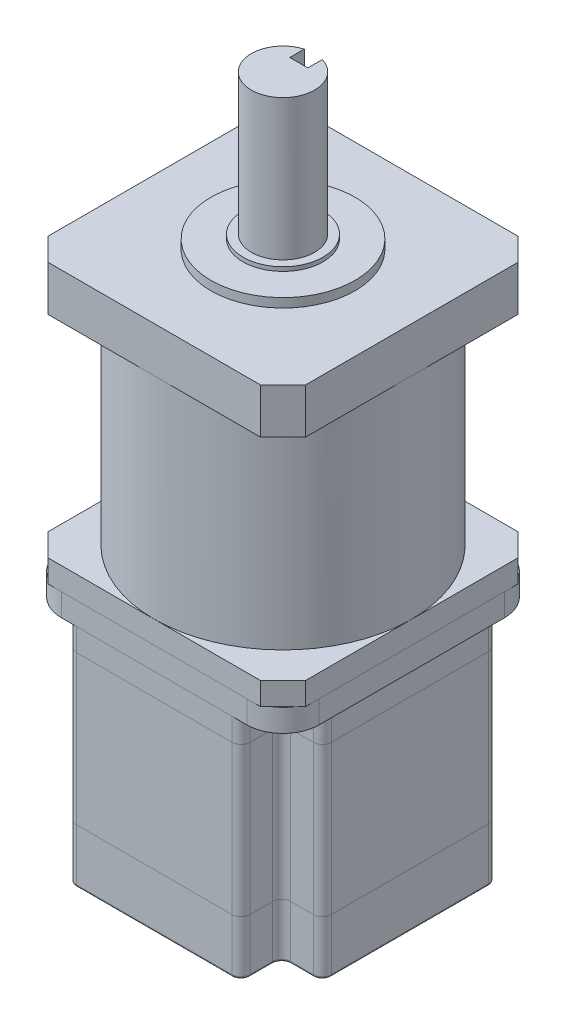
from build123d import *

# Parameters (mm, degrees)
SKETCH1_R            = 28.5
BOSS_EXTRUDE1_DEPTH  = 56.65
SKETCH2_W            = 57
SKETCH2_H            = 57
BOSS_EXTRUDE2_DEPTH  = 5
CHAMFER1_SIZE        = 5
SKETCH3_W            = 57
SKETCH3_H            = 57
BOSS_EXTRUDE3_DEPTH  = 5
SKETCH4_R            = 2.5
CUT_EXTRUDE1_DEPTH   = 15
BOSS_EXTRUDE4_DEPTH  = 5
BOSS_EXTRUDE5_DEPTH  = 33
BOSS_EXTRUDE6_DEPTH  = 12
FILLET1_R            = 2
FILLET2_R            = 2
FILLET3_R            = 2
FILLET4_R            = 0.5
FILLET5_R            = 8
SKETCH9_R            = 15.95
BOSS_EXTRUDE7_DEPTH  = 2
SKETCH10_R           = 8.85
BOSS_EXTRUDE8_DEPTH  = 0.9
SKETCH11_R           = 7
BOSS_EXTRUDE9_DEPTH  = 31.1
SKETCH12_W           = 4
SKETCH12_H           = 5.111692092
CUT_EXTRUDE2_DEPTH   = 20
FILLET6_R            = 2
BOSS_EXTRUDE10_DEPTH = 10


with BuildPart() as part:
    # Sketch1 → Boss-Extrude1 (new body)
    with BuildSketch(Plane(origin=(0, 0, 0), x_dir=(1, 0, 0), z_dir=(0, 1, 0))):
        with Locations(Location((0, 0, 0), (0, 0, 270))):
            Circle(SKETCH1_R)
    extrude(amount=BOSS_EXTRUDE1_DEPTH)

    # Sketch9 → Boss-Extrude7 (add)
    with BuildSketch(Plane(origin=(0, 56.65, 0), x_dir=(1, 0, 0), z_dir=(0, 1, 0))):
        with Locations(Location((0, 0, 0), (0, 0, 270))):
            Circle(SKETCH9_R)
    extrude(amount=BOSS_EXTRUDE7_DEPTH)

    # Sketch13 → Boss-Extrude10 (add)
    with BuildSketch(Plane(origin=(0, 56.65, 0), x_dir=(1, 0, 0), z_dir=(0, 1, 0))):
        Polygon((28.5, -23.5), (28.5, 23.5), (23.5, 28.5), (-23.5, 28.5), (-28.5, 23.5), (-28.5, -23.5), (-23.5, -28.5), (23.5, -28.5), align=None)
    extrude(amount=-BOSS_EXTRUDE10_DEPTH)


with BuildPart() as body_2:
    # Sketch2 → Boss-Extrude2 (new body)
    with BuildSketch(Plane.XZ):
        Rectangle(SKETCH2_W, SKETCH2_H)
    extrude(amount=BOSS_EXTRUDE2_DEPTH)

    # Chamfer1
    chamfer1_edges = [body_2.edges().sort_by_distance(p)[0] for p in [
        (28.5, -2.5, -28.5),
        (-28.5, -2.5, -28.5),
        (-28.5, -2.5, 28.5),
        (28.5, -2.5, 28.5),
    ]]
    chamfer(chamfer1_edges, length=CHAMFER1_SIZE)


with BuildPart() as body_3:
    # Sketch3 → Boss-Extrude3 (new body)
    with BuildSketch(Plane.XZ.offset(5)):
        Rectangle(SKETCH3_W, SKETCH3_H)
    extrude(amount=BOSS_EXTRUDE3_DEPTH)

    # Sketch4 → Cut-Extrude1 (cut)
    with BuildSketch(Plane.XZ.offset(10)):
        with Locations(Location((-23.5, 23.5, 0), (0, 0, 270))):
            Circle(SKETCH4_R)
        with Locations(Location((23.5, 23.5, 0), (0, 0, 270))):
            Circle(SKETCH4_R)
        with Locations(Location((23.5, -23.5, 0), (0, 0, 270))):
            Circle(SKETCH4_R)
        with Locations(Location((-23.5, -23.5, 0), (0, 0, 270))):
            Circle(SKETCH4_R)
    extrude(amount=-CUT_EXTRUDE1_DEPTH, mode=Mode.SUBTRACT)

    # Fillet5
    fillet5_edges = [body_3.edges().sort_by_distance(p)[0] for p in [
        (28.5, -7.5, -28.5),
        (-28.5, -7.5, -28.5),
        (-28.5, -7.5, 28.5),
        (28.5, -7.5, 28.5),
    ]]
    fillet(fillet5_edges, radius=FILLET5_R)


with BuildPart() as body_4:
    # Sketch6 → Boss-Extrude4 (new body)
    with BuildSketch(Plane.XZ.offset(10)):
        Polygon((-19.2, 28.5), (19.2, 28.5), (19.2, 19.5), (28.2, 19.5), (28.2, -19.25), (19.2, -19.25), (19.2, -28.25), (-19.2, -28.25), (-19.2, -19.25), (-28.2, -19.25), (-28.2, 19.5), (-19.2, 19.5), align=None)
    extrude(amount=BOSS_EXTRUDE4_DEPTH)

    # Fillet1
    fillet1_edges = [body_4.edges().sort_by_distance(p)[0] for p in [
        (19.2, -12.5, 19.5),
        (28.2, -12.5, 19.5),
        (28.2, -12.5, -19.25),
        (19.2, -12.5, -19.25),
        (19.2, -12.5, -28.25),
        (-19.2, -12.5, -28.25),
        (-19.2, -12.5, -19.25),
        (-28.2, -12.5, -19.25),
        (-28.2, -12.5, 19.5),
        (-19.2, -12.5, 19.5),
        (-19.2, -12.5, 28.5),
        (19.2, -12.5, 28.5),
    ]]
    fillet(fillet1_edges, radius=FILLET1_R)


with BuildPart() as body_5:
    # Sketch7 → Boss-Extrude5 (new body)
    with BuildSketch(Plane.XZ.offset(15)):
        Polygon((19.2, 19.5), (19.2, 28.5), (-19.2, 28.5), (-19.2, 19.5), (-28.2, 19.5), (-28.2, -19.25), (-19.2, -19.25), (-19.2, -28.25), (19.2, -28.25), (19.2, -19.25), (28.2, -19.25), (28.2, 19.5), align=None)
    extrude(amount=BOSS_EXTRUDE5_DEPTH)

    # Fillet2
    fillet2_edges = [body_5.edges().sort_by_distance(p)[0] for p in [
        (28.2, -31.5, 19.5),
        (28.2, -31.5, -19.25),
        (19.2, -31.5, -19.25),
        (19.2, -31.5, -28.25),
        (-19.2, -31.5, -28.25),
        (-19.2, -31.5, -19.25),
        (-28.2, -31.5, -19.25),
        (-28.2, -31.5, 19.5),
        (-19.2, -31.5, 19.5),
        (-19.2, -31.5, 28.5),
        (19.2, -31.5, 28.5),
        (19.2, -31.5, 19.5),
    ]]
    fillet(fillet2_edges, radius=FILLET2_R)


with BuildPart() as body_6:
    # Sketch8 → Boss-Extrude6 (new body)
    with BuildSketch(Plane.XZ.offset(48)):
        Polygon((28.2, 19.5), (19.2, 19.5), (19.2, 28.5), (-19.2, 28.5), (-19.2, 19.5), (-28.2, 19.5), (-28.2, -19.25), (-19.2, -19.25), (-19.2, -28.25), (19.2, -28.25), (19.2, -19.25), (28.2, -19.25), align=None)
    extrude(amount=BOSS_EXTRUDE6_DEPTH)

    # Fillet3
    fillet3_edges = [body_6.edges().sort_by_distance(p)[0] for p in [
        (28.2, -54, -19.25),
        (19.2, -54, -19.25),
        (19.2, -54, -28.25),
        (-19.2, -54, -28.25),
        (-19.2, -54, -19.25),
        (-28.2, -54, -19.25),
        (-28.2, -54, 19.5),
        (-19.2, -54, 19.5),
        (-19.2, -54, 28.5),
        (19.2, -54, 28.5),
        (19.2, -54, 19.5),
        (28.2, -54, 19.5),
    ]]
    fillet(fillet3_edges, radius=FILLET3_R)

    # Fillet4
    fillet4_edges = [body_6.edges().sort_by_distance(p)[0] for p in [
        (-28.2, -60, 0.125),
        (-23.7, -60, 19.5),
        (28.2, -60, 0.125),
        (23.7, -60, 19.5),
        (19.2, -60, 24),
        (0, -60, 28.5),
        (-19.2, -60, 24),
        (-23.7, -60, -19.25),
        (-19.2, -60, -23.75),
        (0, -60, -28.25),
        (19.2, -60, -23.75),
        (23.7, -60, -19.25),
        (-27.614213562, -60, -18.664213562),
        (-18.614213562, -60, -27.664213562),
        (18.614213562, -60, -27.664213562),
        (27.614213562, -60, -18.664213562),
        (27.614213562, -60, 18.914213562),
        (18.614213562, -60, 27.914213562),
        (-18.614213562, -60, 27.914213562),
        (-27.614213562, -60, 18.914213562),
        (-19.785786438, -60, 20.085786438),
        (19.785786438, -60, 20.085786438),
        (19.785786438, -60, -19.835786438),
        (-19.785786438, -60, -19.835786438),
    ]]
    fillet(fillet4_edges, radius=FILLET4_R)


with BuildPart() as body_7:
    # Sketch10 → Boss-Extrude8 (new body)
    with BuildSketch(Plane(origin=(0, 58.65, 0), x_dir=(1, 0, 0), z_dir=(0, 1, 0))):
        with Locations(Location((0, 0, 0), (0, 0, 270))):
            Circle(SKETCH10_R)
    extrude(amount=BOSS_EXTRUDE8_DEPTH)


with BuildPart() as body_8:
    # Sketch11 → Boss-Extrude9 (new body)
    with BuildSketch(Plane(origin=(0, 59.55, 0), x_dir=(1, 0, 0), z_dir=(0, 1, 0))):
        with Locations(Location((0, 0, 0), (0, 0, 90))):
            Circle(SKETCH11_R)
    extrude(amount=BOSS_EXTRUDE9_DEPTH)

    # Sketch12 → Cut-Extrude2 (cut)
    with BuildSketch(Plane(origin=(0, 90.65, 0), x_dir=(1, 0, 0), z_dir=(0, 1, 0))):
        with Locations((0, 6.055846046)):
            Rectangle(SKETCH12_W, SKETCH12_H)
    extrude(amount=-CUT_EXTRUDE2_DEPTH, mode=Mode.SUBTRACT)

    # Fillet6
    fillet6_edges = [body_8.edges().sort_by_distance(p)[0] for p in [
        (-2, 70.65, -5.104101966),
        (2, 70.65, -5.104101966),
    ]]
    fillet(fillet6_edges, radius=FILLET6_R - 0.0001)  # a hair under: the kernel refuses the full size


solid = Compound([part.part, body_2.part, body_3.part, body_4.part, body_5.part, body_6.part, body_7.part, body_8.part])
